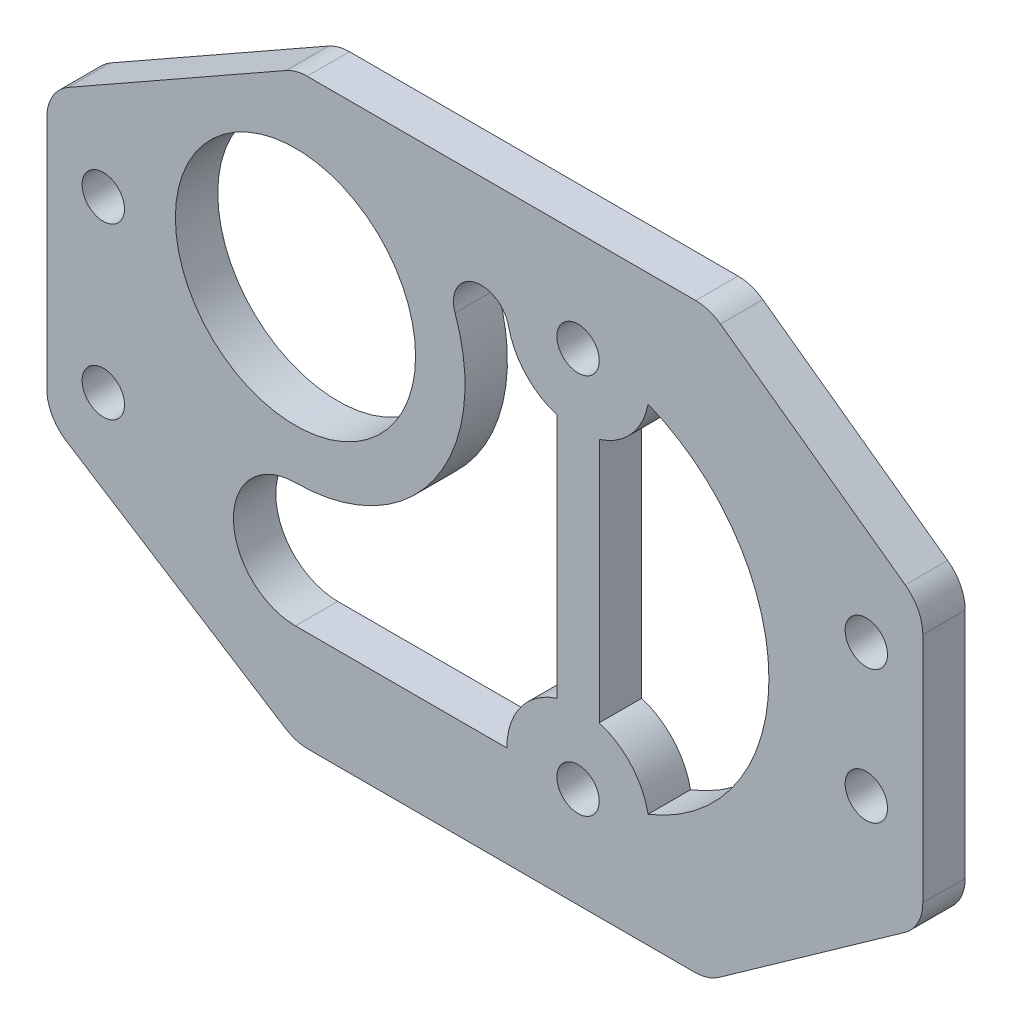
from build123d import *

# Parameters (mm, degrees)
SKETCH1_R           = 1.5
SKETCH1_R_2         = 8.5
BOSS_EXTRUDE1_DEPTH = 3


with BuildPart() as part:
    # Sketch1 → Boss-Extrude1 (new body)
    with BuildSketch(Plane.XY):
        with BuildLine():
            Line((0, 1.64796966), (0, 18.25796966))
            ThreePointArc((0, 18.25796966), (0.407702513, 19.767934474), (1.519995827, 20.867488322))
            Line((1.519995827, 20.867488322), (16.942251121, 29.614312984))
            ThreePointArc((16.942251121, 29.614312984), (17.656930521, 29.905531813), (18.422255294, 30.004794322))
            Line((18.422255294, 30.004794322), (45.922255294, 30.004794322))
            ThreePointArc((45.922255294, 30.004794322), (46.845265991, 29.859273478), (47.678731824, 29.43682849))
            Line((47.678731824, 29.43682849), (60.756476531, 19.991750808))
            ThreePointArc((60.756476531, 19.991750808), (61.671088691, 18.925471084), (62, 17.559716639))
            Line((62, 17.559716639), (62, 1.129716639))
            ThreePointArc((62, 1.129716639), (61.66533053, -0.247241299), (60.735991224, -1.316982049))
            Line((60.735991224, -1.316982049), (47.579391193, -10.651904367))
            ThreePointArc((47.579391193, -10.651904367), (46.754416966, -11.063535266), (45.84339997, -11.205205678))
            Line((45.84339997, -11.205205678), (18.50339997, -11.205205678))
            ThreePointArc((18.50339997, -11.205205678), (17.66547208, -11.085809235), (16.894241264, -10.73712358))
            Line((16.894241264, -10.73712358), (1.390841294, -0.883948242))
            ThreePointArc((1.390841294, -0.883948242), (0.370601198, 0.203579844), (0, 1.64796966))
        make_face()
        with Locations((4, 15.399794322)):
            Circle(SKETCH1_R, mode=Mode.SUBTRACT)
        with Locations((4, 3.399794322)):
            Circle(SKETCH1_R, mode=Mode.SUBTRACT)
        with Locations((58, 15.091750808)):
            Circle(SKETCH1_R, mode=Mode.SUBTRACT)
        with Locations((58, 5.678289269)):
            Circle(SKETCH1_R, mode=Mode.SUBTRACT)
        with Locations((37.6, 22.899794322)):
            Circle(SKETCH1_R, mode=Mode.SUBTRACT)
        with Locations((37.6, -4.100205678)):
            Circle(SKETCH1_R, mode=Mode.SUBTRACT)
        with Locations((17.6, 16.679794322)):
            Circle(SKETCH1_R_2, mode=Mode.SUBTRACT)
        with BuildLine():
            Line((39.1, 0.713961497), (39.1, 18.085627146))
            ThreePointArc((39.1, 18.085627146), (41.365876, 19.546529711), (42.555224583, 21.966009055))
            ThreePointArc((42.555224583, 21.966009055), (51.107923726, 9.399794322), (42.555224583, -3.166420412))
            ThreePointArc((42.555224583, -3.166420412), (41.365876, -0.746941068), (39.1, 0.713961497))
        make_face(mode=Mode.SUBTRACT)
        with BuildLine():
            Line((36.1, 18.085627146), (36.1, 0.713961497))
            ThreePointArc((36.1, 0.713961497), (33.538604534, -1.111682219), (32.55755956, -4.100205678))
            Line((32.55755956, -4.100205678), (17.6, -4.100205678))
            ThreePointArc((17.6, -4.100205678), (13.21, 0.289794322), (17.6, 4.679794322))
            ThreePointArc((17.6, 4.679794322), (27.411976087, 9.771456948), (28.897406852, 20.725606777))
            ThreePointArc((28.897406852, 20.725606777), (30.206772534, 23.282822768), (32.675850225, 21.813997568))
            ThreePointArc((32.675850225, 21.813997568), (33.886159456, 19.488988843), (36.1, 18.085627146))
        make_face(mode=Mode.SUBTRACT)
    extrude(amount=BOSS_EXTRUDE1_DEPTH)


solid = part.part
